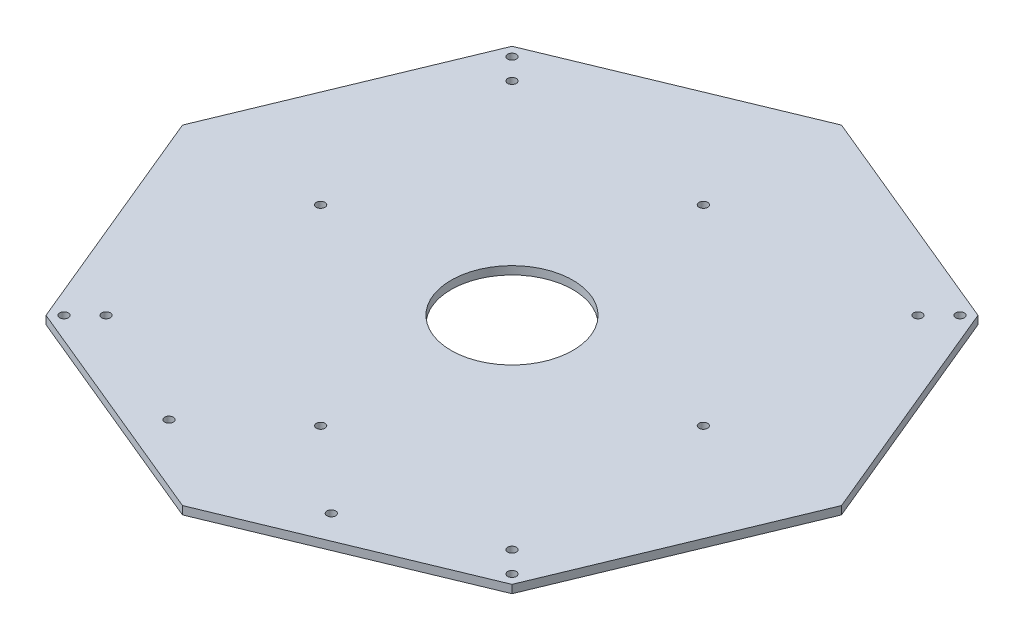
from build123d import *

# Parameters (mm, degrees)
BOSS_EXTRUDE2_DEPTH     = 3
CUT_EXTRUDE3_DEPTH      = 173.233673841
CUT_EXTRUDE3_DEPTH_BACK = 173.233673841
SKETCH3_R               = 1.6
CUT_EXTRUDE4_DEPTH      = 173.233673841
CUT_EXTRUDE4_DEPTH_BACK = 173.233673841
SKETCH4_R               = 1.6
CUT_EXTRUDE5_DEPTH      = 173.233673841
CUT_EXTRUDE5_DEPTH_BACK = 173.233673841
SKETCH5_R               = 1.6
CUT_EXTRUDE6_DEPTH      = 173.233673841
CUT_EXTRUDE6_DEPTH_BACK = 173.233673841
SKETCH6_R               = 22.5


with BuildPart() as part:
    # Sketch1 → Boss-Extrude2 (new body)
    with BuildSketch(Plane(origin=(0, 0, 0), x_dir=(1, 0, 0), z_dir=(0, 1, 0))):
        Polygon((0, -121.769122533), (86.103772282, -86.103772282), (121.769122533, 0), (86.103772282, 86.103772282), (0, 121.769122533), (-86.103772282, 86.103772282), (-121.769122533, 0), (-86.103772282, -86.103772282), align=None)
    extrude(amount=BOSS_EXTRUDE2_DEPTH)

    # Sketch3 → Cut-Extrude3 (cut, two sides: drawn at the far end of the back side and taken through both)
    with BuildSketch(Plane(origin=(0, 3, 0), x_dir=(1, 0, 0), z_dir=(0, 1, 0)).offset(-CUT_EXTRUDE3_DEPTH_BACK)):
        with Locations((-75, -75)):
            Circle(SKETCH3_R)
        with Locations((75, -75)):
            Circle(SKETCH3_R)
        with Locations((75, 75)):
            Circle(SKETCH3_R)
        with Locations((-75, 75)):
            Circle(SKETCH3_R)
        with Locations((-70.710678119, 0)):
            Circle(SKETCH3_R)
        with Locations((0, 70.710678119)):
            Circle(SKETCH3_R)
        with Locations((70.710678119, 0)):
            Circle(SKETCH3_R)
        with Locations((0, -70.710678119)):
            Circle(SKETCH3_R)
    extrude(amount=CUT_EXTRUDE3_DEPTH + CUT_EXTRUDE3_DEPTH_BACK, mode=Mode.SUBTRACT)

    # Sketch4 → Cut-Extrude4 (cut, two sides: drawn at the far end of the back side and taken through both)
    with BuildSketch(Plane(origin=(0, 3, 0), x_dir=(1, 0, 0), z_dir=(0, 1, 0)).offset(-CUT_EXTRUDE4_DEPTH_BACK)):
        with Locations((-30, -96.769122533)):
            Circle(SKETCH4_R)
        with Locations((30, -96.769122533)):
            Circle(SKETCH4_R)
    extrude(amount=CUT_EXTRUDE4_DEPTH + CUT_EXTRUDE4_DEPTH_BACK, mode=Mode.SUBTRACT)

    # Sketch5 → Cut-Extrude5 (cut, two sides: drawn at the far end of the back side and taken through both)
    with BuildSketch(Plane(origin=(0, 3, 0), x_dir=(1, 0, 0), z_dir=(0, 1, 0)).offset(-CUT_EXTRUDE5_DEPTH_BACK)):
        with Locations((-82.778174593, -82.778174593)):
            Circle(SKETCH5_R)
        with Locations((-82.778174593, 82.778174593)):
            Circle(SKETCH5_R)
        with Locations((82.778174593, 82.778174593)):
            Circle(SKETCH5_R)
        with Locations((82.778174593, -82.778174593)):
            Circle(SKETCH5_R)
    extrude(amount=CUT_EXTRUDE5_DEPTH + CUT_EXTRUDE5_DEPTH_BACK, mode=Mode.SUBTRACT)

    # Sketch6 → Cut-Extrude6 (cut, two sides: drawn at the far end of the back side and taken through both)
    with BuildSketch(Plane(origin=(0, 3, 0), x_dir=(1, 0, 0), z_dir=(0, 1, 0)).offset(-CUT_EXTRUDE6_DEPTH_BACK)):
        Circle(SKETCH6_R)
    extrude(amount=CUT_EXTRUDE6_DEPTH + CUT_EXTRUDE6_DEPTH_BACK, mode=Mode.SUBTRACT)


solid = part.part
